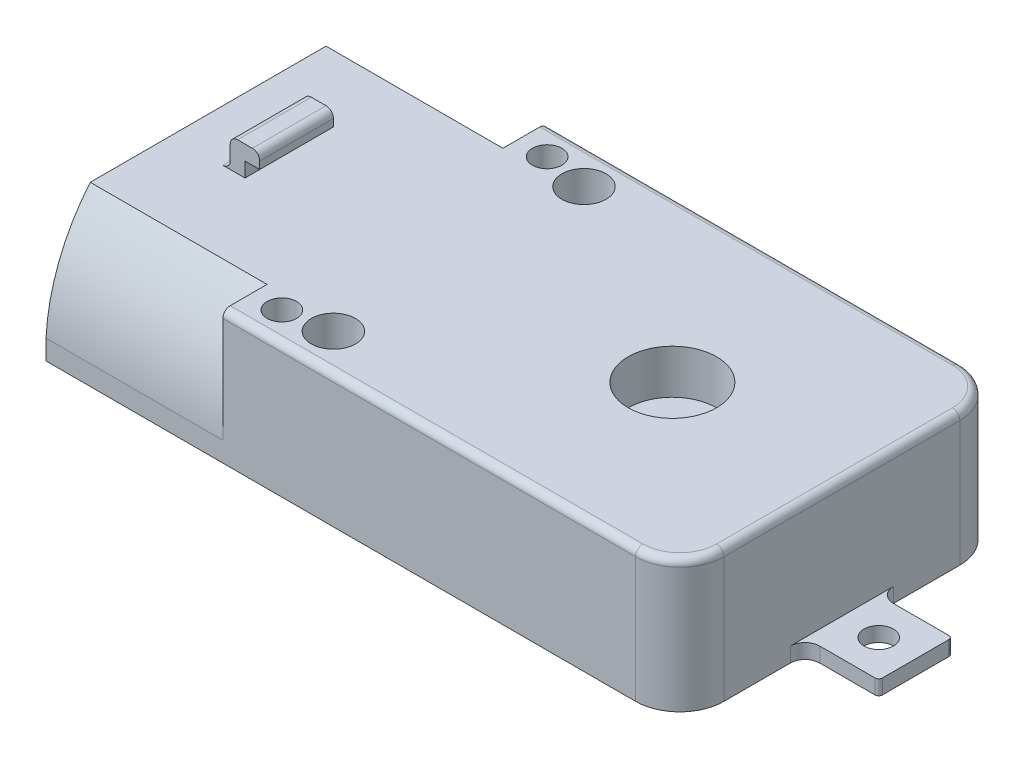
from build123d import *

# Parameters (mm, degrees)
SKETCH2_W           = 31
SKETCH2_H           = 22
BOSS_EXTRUDE2_DEPTH = 9
SKETCH4_W           = 5
SKETCH4_H           = 1
BOSS_EXTRUDE3_DEPTH = 5
SKETCH5_R           = 1
CUT_EXTRUDE1_DEPTH  = 5
FILLET1_R           = 1
FILLET2_R           = 1
FILLET3_R           = 3
FILLET4_R           = 3
BOSS_EXTRUDE4_DEPTH = 12
FILLET5_R           = 0.5
FILLET6_R           = 0.25
SKETCH8_R           = 3
CUT_EXTRUDE3_DEPTH  = 3
SKETCH9_R           = 0.75
CUT_EXTRUDE4_DEPTH  = 3
SKETCH10_R          = 1.5
CUT_EXTRUDE7_DEPTH  = 44.13930922
SKETCH12_R          = 1
CUT_EXTRUDE8_DEPTH  = 5
SKETCH13_W          = 1
SKETCH13_H          = 5
BOSS_EXTRUDE5_DEPTH = 2
SKETCH14_W          = 5
SKETCH14_H          = 1
BOSS_EXTRUDE6_DEPTH = 1
FILLET7_R           = 0.5
FILLET8_R           = 0.5
FILLET9_R           = 0.5
CUT_EXTRUDE9_DEPTH  = 10


with BuildPart() as part:
    # Sketch2 → Boss-Extrude2 (new body)
    with BuildSketch(Plane(origin=(0, 0, 0), x_dir=(1, 0, 0), z_dir=(0, 1, 0))):
        with Locations((15.5, 11)):
            Rectangle(SKETCH2_W, SKETCH2_H)
    extrude(amount=BOSS_EXTRUDE2_DEPTH)

    # Sketch4 → Boss-Extrude3 (add)
    with BuildSketch(Plane(origin=(31, 0, 0), x_dir=(0, 0, -1), z_dir=(1, 0, 0))):
        with Locations((11, 0.5)):
            Rectangle(SKETCH4_W, SKETCH4_H)
    extrude(amount=BOSS_EXTRUDE3_DEPTH)

    # Sketch5 → Cut-Extrude1 (cut)
    with BuildSketch(Plane(origin=(0, 1, 0), x_dir=(1, 0, 0), z_dir=(0, 1, 0))):
        with Locations((33.5, 11)):
            Circle(SKETCH5_R)
    extrude(amount=-CUT_EXTRUDE1_DEPTH, mode=Mode.SUBTRACT)

    # Fillet1
    fillet1_edges = [part.edges().sort_by_distance(p)[0] for p in [
        (31, 0.5, -8.5),
    ]]
    fillet(fillet1_edges, radius=FILLET1_R)

    # Fillet2
    fillet2_edges = [part.edges().sort_by_distance(p)[0] for p in [
        (31, 0.5, -13.5),
    ]]
    fillet(fillet2_edges, radius=FILLET2_R)

    # Fillet3
    fillet3_edges = [part.edges().sort_by_distance(p)[0] for p in [
        (31, 4.5, 0),
    ]]
    fillet(fillet3_edges, radius=FILLET3_R)

    # Fillet4
    fillet4_edges = [part.edges().sort_by_distance(p)[0] for p in [
        (31, 4.5, -22),
    ]]
    fillet(fillet4_edges, radius=FILLET4_R)

    # Sketch6 → Boss-Extrude4 (add)
    with BuildSketch(Plane.ZY):
        with BuildLine():
            Line((-22, 0), (0, 0))
            Line((0, 0), (0, 1.344936316))
            ThreePointArc((0, 1.344936316), (-0.878877088, 5.415884648), (-3, 9))
            Line((-3, 9), (-19, 9))
            ThreePointArc((-19, 9), (-21.121122912, 5.415884648), (-22, 1.344936316))
            Line((-22, 1.344936316), (-22, 0))
        make_face()
    extrude(amount=BOSS_EXTRUDE4_DEPTH)

    # Fillet5
    fillet5_edges = [part.edges().sort_by_distance(p)[0] for p in [
        (14, 9, -22),
        (30.121320344, 9, -21.121320344),
        (31, 9, -11),
        (30.121320344, 9, -0.878679656),
        (14, 9, 0),
    ]]
    fillet(fillet5_edges, radius=FILLET5_R)

    # Fillet6
    fillet6_edges = [part.edges().sort_by_distance(p)[0] for p in [
        (36, 0.5, -13.5),
        (36, 0.5, -8.5),
    ]]
    fillet(fillet6_edges, radius=FILLET6_R)

    # Sketch8 → Cut-Extrude3 (cut)
    with BuildSketch(Plane(origin=(0, 9, 0), x_dir=(1, 0, 0), z_dir=(0, 1, 0))):
        with Locations((19.5, 11)):
            Circle(SKETCH8_R)
    extrude(amount=-CUT_EXTRUDE3_DEPTH, mode=Mode.SUBTRACT)

    # Sketch9 → Cut-Extrude4 (cut)
    with BuildSketch(Plane(origin=(0, 6, 0), x_dir=(1, 0, 0), z_dir=(0, 1, 0))):
        with Locations((19.5, 11)):
            Circle(SKETCH9_R)
    extrude(amount=-CUT_EXTRUDE4_DEPTH, mode=Mode.SUBTRACT)

    # Sketch10 → Cut-Extrude7 (cut, through all)
    with BuildSketch(Plane(origin=(0, 9, 0), x_dir=(1, 0, 0), z_dir=(0, 1, 0))):
        with Locations((5, 19.5)):
            Circle(SKETCH10_R)
        with Locations((5, 2.5)):
            Circle(SKETCH10_R)
    extrude(amount=-CUT_EXTRUDE7_DEPTH, mode=Mode.SUBTRACT)

    # Sketch12 → Cut-Extrude8 (cut)
    with BuildSketch(Plane(origin=(0, 9, 0), x_dir=(1, 0, 0), z_dir=(0, 1, 0))):
        with Locations((2, 2)):
            Circle(SKETCH12_R)
        with Locations((2, 20)):
            Circle(SKETCH12_R)
    extrude(amount=-CUT_EXTRUDE8_DEPTH, mode=Mode.SUBTRACT)

    # Sketch13 → Boss-Extrude5 (add)
    with BuildSketch(Plane(origin=(0, 9, 0), x_dir=(1, 0, 0), z_dir=(0, 1, 0))):
        with Locations((-7.5, 11)):
            Rectangle(SKETCH13_W, SKETCH13_H)
    extrude(amount=BOSS_EXTRUDE5_DEPTH)

    # Sketch14 → Boss-Extrude6 (add)
    with BuildSketch(Plane(origin=(-7, 0, 0), x_dir=(0, 0, -1), z_dir=(1, 0, 0))):
        with Locations((11, 10.5)):
            Rectangle(SKETCH14_W, SKETCH14_H)
    extrude(amount=BOSS_EXTRUDE6_DEPTH)

    # Fillet7
    fillet7_edges = [part.edges().sort_by_distance(p)[0] for p in [
        (-8, 11, -11),
    ]]
    fillet(fillet7_edges, radius=FILLET7_R)

    # Fillet8
    fillet8_edges = [part.edges().sort_by_distance(p)[0] for p in [
        (-8, 9, -11),
    ]]
    fillet(fillet8_edges, radius=FILLET8_R)

    # Fillet9
    fillet9_edges = [part.edges().sort_by_distance(p)[0] for p in [
        (-6, 11, -11),
    ]]
    fillet(fillet9_edges, radius=FILLET9_R)

    # Sketch16 → Cut-Extrude9 (cut)
    with BuildSketch(Plane.ZY.offset(12)):
        with BuildLine():
            Line((-18.232108037, 8.359420628), (-3.767891963, 8.359420628))
            ThreePointArc((-3.767891963, 8.359420628), (-1.809932353, 5.051006457), (-0.998661194, 1.293207997))
            Line((-0.998661194, 1.293207997), (-0.998661194, 0))
            Line((-0.998661194, 0), (-21, 0))
            Line((-21, 0), (-21.001338806, 1.293207997))
            ThreePointArc((-21.001338806, 1.293207997), (-20.190067647, 5.051006457), (-18.232108037, 8.359420628))
        make_face()
    extrude(amount=-CUT_EXTRUDE9_DEPTH, mode=Mode.SUBTRACT)


solid = part.part
